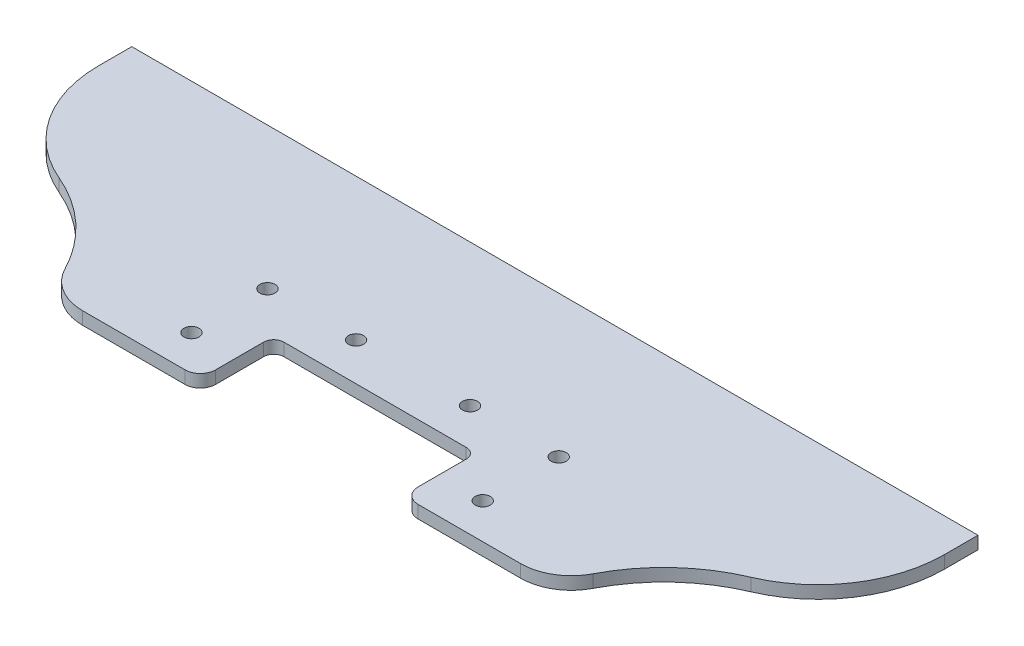
from build123d import *

# Parameters (mm, degrees)
SKETCH1_W              = 209.55
SKETCH1_H              = 80.01
BOSS_EXTRUDE1_DEPTH    = 3.175
SKETCH3_R              = 1.89865
CUT_EXTRUDE1_DEPTH     = 113.197510111
SKETCH29_W             = 209.55
SKETCH29_H             = 16.51
CUT_EXTRUDE6_DEPTH     = 113.197510111
BOSS_EXTRUDE6_DEPTH    = 63.5
CUT_EXTRUDE3_DEPTH     = 138.912061642
CUT_EXTRUDE4_DEPTH     = 138.357542769
CUT_EXTRUDE7_REACH     = 139.912
SKETCH30_W             = 50.8
SKETCH30_H             = 18.415
CUT_EXTRUDE9_DEPTH     = 138.912061642
FILLET6_R              = 12.7
FILLET8_R              = 2.54
FILLET9_R              = 3.81
FILLET11_R             = 31.75
CONVERT_SOLID4_START   = -2
CONVERT_SOLID4_DEPTH   = 2
CONVERT_SOLID4_2_DEPTH = 3.175


with BuildPart() as part:
    # Sketch1 → Boss-Extrude1 (new body)
    with BuildSketch(Plane(origin=(0, 0, 0), x_dir=(1, 0, 0), z_dir=(0, 1, 0))):
        Rectangle(SKETCH1_W, SKETCH1_H)
    extrude(amount=BOSS_EXTRUDE1_DEPTH)

    # Sketch3 → Cut-Extrude1 (cut, through all)
    with BuildSketch(Plane(origin=(0, 3.175, 0), x_dir=(1, 0, 0), z_dir=(0, 1, 0))):
        with Locations(Location((36.5125, -14.605, 0), (0, 0, 270))):
            Circle(SKETCH3_R)
        with Locations(Location((14.2875, -14.605, 0), (0, 0, 270))):
            Circle(SKETCH3_R)
        with Locations(Location((-14.2875, -14.605, 0), (0, 0, 270))):
            Circle(SKETCH3_R)
        with Locations(Location((-36.5125, -14.605, 0), (0, 0, 270))):
            Circle(SKETCH3_R)
        with Locations(Location((36.5125, 4.445, 0), (0, 0, 270))):
            Circle(SKETCH3_R)
        with Locations(Location((14.2875, 4.445, 0), (0, 0, 270))):
            Circle(SKETCH3_R)
        with Locations(Location((-14.2875, 4.445, 0), (0, 0, 270))):
            Circle(SKETCH3_R)
        with Locations(Location((-36.5125, 4.445, 0), (0, 0, 270))):
            Circle(SKETCH3_R)
    extrude(amount=-CUT_EXTRUDE1_DEPTH, mode=Mode.SUBTRACT)

    # Sketch29 → Cut-Extrude6 (cut, through all)
    with BuildSketch(Plane(origin=(0, 3.175, 0), x_dir=(1, 0, 0), z_dir=(0, 1, 0))):
        with Locations((0, -31.75)):
            Rectangle(SKETCH29_W, SKETCH29_H)
    extrude(amount=-CUT_EXTRUDE6_DEPTH, mode=Mode.SUBTRACT)

    # Sketch19 → Boss-Extrude6 (add, through all)
    with BuildSketch(Plane(origin=(0, 0, -40.005), x_dir=(-1, 0, 0), z_dir=(0, 0, -1))):
        Polygon((-104.775, 0), (-127.225640303, -22.450640303), (-129.470704333, -20.205576272), (-106.090128061, 3.175), (-104.775, 3.175), align=None)
    boss_extrude6 = extrude(amount=-BOSS_EXTRUDE6_DEPTH)

    # Sketch25 → Cut-Extrude3 (cut, through all)
    with BuildSketch(Plane(origin=(0, 3.175, 0), x_dir=(1, 0, 0), z_dir=(0, 1, 0))):
        with BuildLine():
            Line((144.190128061, 11.508273959), (97.502219088, 5.361694136))
            ThreePointArc((97.502219088, 5.361694136), (75.663289052, -66.631609949), (144.190128061, -35.58250314))
            Line((144.190128061, -35.58250314), (144.190128061, 11.508273959))
        make_face()
    cut_extrude3 = extrude(amount=-CUT_EXTRUDE3_DEPTH, mode=Mode.SUBTRACT)

    # Sketch26 → Cut-Extrude4 (cut, through all)
    with BuildSketch(Plane(origin=(0, 0, 0), x_dir=(0, 0, -1), z_dir=(1, 0, 0))):
        Polygon((40.005, 3.175), (14.379359697, -22.450640303), (40.005, -22.450640303), align=None)
    cut_extrude4 = extrude(amount=CUT_EXTRUDE4_DEPTH, mode=Mode.SUBTRACT)

    # Sketch30 → Cut-Extrude7 (cut, up to next)
    with BuildSketch(Plane(origin=(0, 3.175, 0), x_dir=(1, 0, 0), z_dir=(0, 1, 0)), mode=Mode.PRIVATE) as cut_extrude7_sk1:
        with Locations((0, -14.2875)):
            Rectangle(SKETCH30_W, SKETCH30_H)
    cut_extrude7_tool1 = extrude(cut_extrude7_sk1.sketch, amount=-CUT_EXTRUDE7_REACH, mode=Mode.PRIVATE) & part.part
    add(cut_extrude7_tool1.solids().sort_by_distance((0, 3.175, 14.2875))[0], mode=Mode.SUBTRACT)

    # Mirror9: Boss-Extrude6, Cut-Extrude3, Cut-Extrude4 across plane
    add(boss_extrude6.mirror(Plane(origin=(0, 0, 0), x_dir=(0, 0, 1), z_dir=(1, 0, 0))))
    add(cut_extrude3.mirror(Plane(origin=(0, 0, 0), x_dir=(0, 0, 1), z_dir=(1, 0, 0))), mode=Mode.SUBTRACT)
    add(cut_extrude4.mirror(Plane(origin=(0, 0, 0), x_dir=(0, 0, 1), z_dir=(1, 0, 0))), mode=Mode.SUBTRACT)

    # Sketch32 → Cut-Extrude9 (cut, through all)
    with BuildSketch(Plane(origin=(0, 3.175, 0), x_dir=(1, 0, 0), z_dir=(0, 1, 0))):
        Polygon((-106.090128061, 6.492313801), (-106.090128061, 40.005), (-129.470704333, 16.624423728), (-129.470704333, 9.570425062), align=None)
        Polygon((106.090128061, 6.492313801), (106.090128061, 40.005), (129.470704333, 16.624423728), (129.470704333, 9.570425062), align=None)
    extrude(amount=-CUT_EXTRUDE9_DEPTH, mode=Mode.SUBTRACT)

    # Fillet6
    fillet6_edges = [part.edges().sort_by_distance(p)[0] for p in [
        (-63.403689339, 1.5875, 23.495),
        (63.403689339, 1.5875, 23.495),
    ]]
    fillet(fillet6_edges, radius=FILLET6_R)

    # Fillet8
    fillet8_edges = [part.edges().sort_by_distance(p)[0] for p in [
        (25.4, 1.5875, 5.08),
        (-25.4, 1.5875, 5.08),
    ]]
    fillet(fillet8_edges, radius=FILLET8_R)

    # Fillet9
    fillet9_edges = [part.edges().sort_by_distance(p)[0] for p in [
        (25.4, 1.5875, 23.495),
        (-25.4, 1.5875, 23.495),
    ]]
    fillet(fillet9_edges, radius=FILLET9_R)

    # Fillet11
    # the kernel refuses this fillet: 31.75 mm, written as the material it takes off along each edge
    with BuildSketch(Plane(origin=(-106.090128061, 66.078198255, -6.492313801), x_dir=(0.9786385895506081, 0, 0.20558820744973783), z_dir=(0, -1, 0))) as fillet11_piece_1:
        with BuildLine():
            CenterArc((25.898912909, -31.151224474), FILLET11_R, 101.145067179, 66.990998507)
            Line((-5.172862309, -24.623798888), (-8.280039831, -23.971056329))
            Line((-8.280039831, -23.971056329), (-3.107177522, 0.652742559))
            Line((-3.107177522, 0.652742559), (0.241590205, 3.165795188))
            ThreePointArc((0.241590205, 3.165795188), (8.8784914, 2.506690411), (19.14812824, 3.115122447))
            Line((19.14812824, 3.115122447), (19.761835937, 0))
        make_face()
    extrude(amount=130.296524571, mode=Mode.SUBTRACT)
    with BuildSketch(Plane(origin=(106.090128061, 66.078198255, -6.492313801), x_dir=(-0.9786385895506081, 0, 0.20558820744973783), z_dir=(0, -1, 0))) as fillet11_piece_2:
        with BuildLine():
            CenterArc((25.898912909, 31.151224474), FILLET11_R, 191.863934313, 66.990998507)
            Line((-5.172862309, 24.623798888), (-8.280039831, 23.971056329))
            Line((-8.280039831, 23.971056329), (-3.107177522, -0.652742559))
            Line((-3.107177522, -0.652742559), (0.241590205, -3.165795188))
            ThreePointArc((0.241590205, -3.165795188), (8.8784914, -2.506690411), (19.14812824, -3.115122447))
            Line((19.14812824, -3.115122447), (19.761835937, 0))
        make_face()
    extrude(amount=130.296524571, mode=Mode.SUBTRACT)

    # Convert-Solid4: read off the stored shape, not the designer's step
    # Convert-Solid4 outline → Convert-Solid4 (cut)
    with BuildSketch(Plane(origin=(0, 0, 0), x_dir=(1, 0, 0), z_dir=(0, 1, 0)).offset(CONVERT_SOLID4_START)):
        with BuildLine():
            Line((106.090128061, 31.653593103), (106.090128061, 40.005))
            Line((106.090128061, 40.005), (-106.090128061, 40.005))
            Line((-106.090128061, 40.005), (-106.090128061, 31.653593103))
            ThreePointArc((-106.090128061, 31.653593103), (-105.626557255, 26.247869444), (-104.249381712, 21))
            Line((-104.249381712, 21), (104.249381712, 21))
            ThreePointArc((104.249381712, 21), (105.626557255, 26.247869444), (106.090128061, 31.653593103))
        make_face()
    extrude(amount=CONVERT_SOLID4_DEPTH, mode=Mode.SUBTRACT)

    # Convert-Solid4 2 outline → Convert-Solid4 2 (add)
    with BuildSketch(Plane(origin=(0, 0, 0), x_dir=(1, 0, 0), z_dir=(0, 1, 0))):
        with BuildLine():
            Line((106.090128061, 31.653593103), (106.090128061, 40.005))
            Line((106.090128061, 40.005), (-106.090128061, 40.005))
            Line((-106.090128061, 40.005), (-106.090128061, 31.653593103))
            ThreePointArc((-106.090128061, 31.653593103), (-105.626557255, 26.247869444), (-104.249381712, 21))
            Line((-104.249381712, 21), (104.249381712, 21))
            ThreePointArc((104.249381712, 21), (105.626557255, 26.247869444), (106.090128061, 31.653593103))
        make_face()
    extrude(amount=CONVERT_SOLID4_2_DEPTH)


solid = part.part
